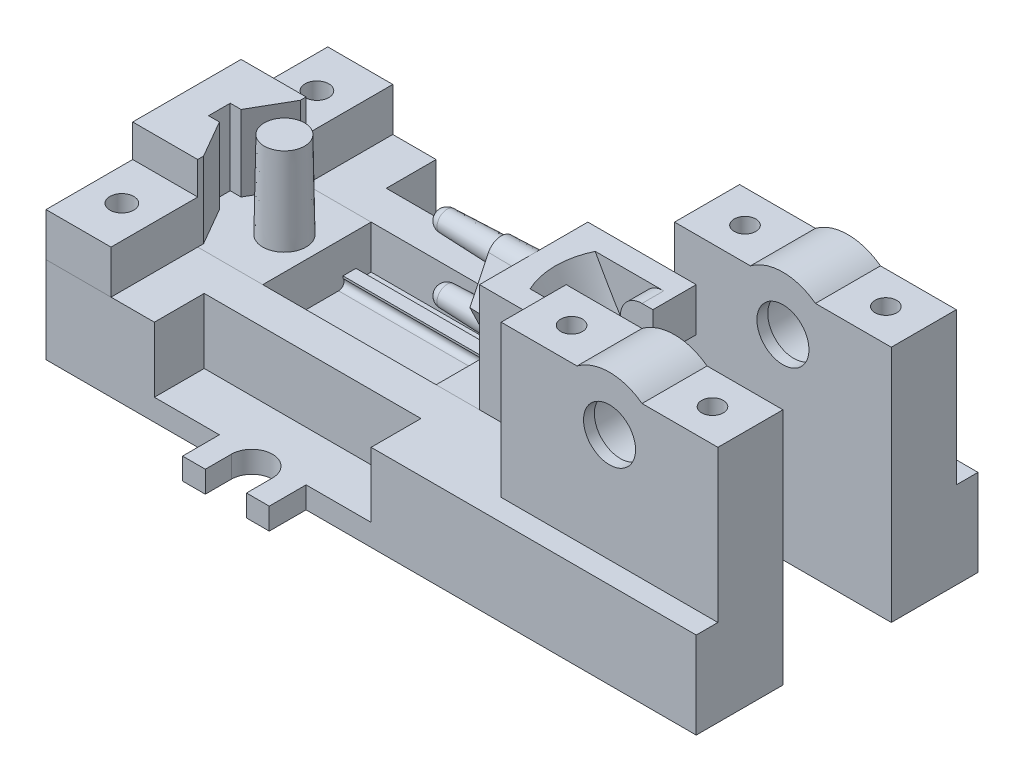
from build123d import *

# Parameters (mm, degrees)
SKETCH_1_W                = 200
SKETCH_1_H                = 50
EXTRUDE_1_DEPTH           = 200
EXTRUDE_2_DEPTH           = 35
SKETCH_3_W                = 30
SKETCH_3_H                = 40
SKETCH_3_R                = 5.5
EXTRUDE_3_DEPTH           = 20
CUT_EXTRUDE_6_DEPTH       = 200
EXTRUDE_4_DEPTH           = 60
SKETCH_6_R                = 10
EXTRUDE_5_DEPTH           = 40
EXTRUDE_5_TAPER           = 1
EXTRUDE_6_DEPTH           = 60
SKETCH_8_W                = 10
SKETCH_8_H                = 50
EXTRUDE_7_DEPTH           = 50
SKETCH_9_R                = 6
EXTRUDE_8_DEPTH           = 40
EXTRUDE_8_DRAFT           = 2
EXTRUDE_8_PROFILE_2_DEPTH = 40
EXTRUDE_8_PROFILE_2_DRAFT = 2
EXTRUDE_9_OUTLINE_R       = 5.476188458
EXTRUDE_9_DEPTH           = 15
EXTRUDE_9_TAPER           = -2
EXTRUDE_10_DEPTH          = 20
FILLET_1_R                = 10
EXTRUDE_11_DEPTH          = 100
EXTRUDE_12_DEPTH          = 30
SKETCH_19_W               = 5
SKETCH_19_H               = 3
EXTRUDE_13_REACH          = 383.608
EXTRUDE_13_END_RADIUS     = 25
SKETCH_22_W               = 30
SKETCH_22_H               = 20
SKETCH_18_W               = 100
SKETCH_18_H               = 50
CUT_EXTRUDE_7_DEPTH       = 50
CHAMFER_1_SIZE2           = 20
CHAMFER_1_SIZE            = 10
MIRROR_START              = 125
MIRROR_1_OUTLINE_R        = 15
MIRROR_1_DEPTH            = 30
MIRROR_1_2_OUTLINE_R      = 15
MIRROR_1_2_OUTLINE_R_2    = 12
MIRROR_1_2_DEPTH          = 5
MIRROR_START_2            = 150
MIRROR_1_3_OUTLINE_R      = 15
MIRROR_1_3_OUTLINE_R_2    = 12
MIRROR_1_3_DEPTH          = 5
CHAMFER_START             = 75
CHAMFER_2_DEPTH           = 50
CUT_EXTRUDE_8_DEPTH       = 369.272996566
CUT_EXTRUDE_8_DEPTH_BACK  = 369.272996566
SKETCH_23_W               = 180
SKETCH_23_H               = 17
CUT_EXTRUDE_10_DEPTH      = 10
SKETCH_25_W               = 100
SKETCH_25_H               = 40
CUT_EXTRUDE_9_DEPTH       = 30
SKETCH_27_R               = 5
CUT_EXTRUDE_11_DEPTH      = 15
SKETCH_28_R               = 5
CUT_EXTRUDE_12_DEPTH      = 35


with BuildPart() as part:
    # 草图1 → 凸台-拉伸1 (new body)
    with BuildSketch(Plane.XY):
        with Locations((100, 25)):
            Rectangle(SKETCH_1_W, SKETCH_1_H)
    extrude(amount=EXTRUDE_1_DEPTH)

    # 草图2 → 凸台-拉伸2 (add)
    with BuildSketch(Plane(origin=(0, 50, 0), x_dir=(1, 0, 0), z_dir=(0, 1, 0))):
        Polygon((0, -75), (30, -75), (30, -77.679491924), (20, -95), (15, -95), (15, -100), (15, -105), (20, -105), (30, -122.320508076), (30, -125), (0, -125), align=None)
    extrude(amount=EXTRUDE_2_DEPTH)

    # 草图3 → 凸台-拉伸3 (add)
    # profile 1 of 2: a face of its own
    with BuildSketch(Plane(origin=(0, 50, 0), x_dir=(1, 0, 0), z_dir=(0, 1, 0))):
        with Locations((15, -55)):
            Rectangle(SKETCH_3_W, SKETCH_3_H)
        with Locations(Location((15, -55, 0), (0, 0, 270))):
            Circle(SKETCH_3_R, mode=Mode.SUBTRACT)
    # profile 2 of 2: a face of its own
    with BuildSketch(Plane(origin=(0, 50, 0), x_dir=(1, 0, 0), z_dir=(0, 1, 0))):
        with Locations((15, -145)):
            Rectangle(SKETCH_3_W, SKETCH_3_H)
        with Locations(Location((15, -145, 0), (0, 0, 270))):
            Circle(SKETCH_3_R, mode=Mode.SUBTRACT)
    extrude(amount=EXTRUDE_3_DEPTH)


with BuildPart() as body_2:
    # Split Bodies 1: read off the stored shape, not the designer's step
    # Split Bodies 1: the piece on the far side of the plane
    add(part.part)
    split(bisect_by=Plane(origin=(0, 50, 0), x_dir=(1, 0, 0), z_dir=(0, 1, 0)), keep=Keep.BOTTOM)

    # 草图4 → 切除-拉伸6 (cut)
    with BuildSketch(Plane.ZY):
        with BuildLine():
            Line((100, 30), (100, 50))
            Line((100, 50), (75, 50))
            Line((75, 50), (75, 30))
            Line((75, 30), (80, 30))
            ThreePointArc((80, 30), (82.236067977, 31.381966011), (82, 34))
            Line((82, 34), (82, 35))
            Line((82, 35), (88, 35))
            Line((88, 35), (88, 34))
            ThreePointArc((88, 34), (87.763932023, 31.381966011), (90, 30))
            Line((90, 30), (100, 30))
        make_face()
        with BuildLine():
            Line((125, 30), (125, 50))
            Line((125, 50), (100, 50))
            Line((100, 50), (100, 30))
            Line((100, 30), (110, 30))
            ThreePointArc((110, 30), (112.236067977, 31.381966011), (112, 34))
            Line((112, 34), (112, 35))
            Line((112, 35), (118, 35))
            Line((118, 35), (118, 34))
            ThreePointArc((118, 34), (117.763932023, 31.381966011), (120, 30))
            Line((120, 30), (125, 30))
        make_face()
    extrude(amount=-CUT_EXTRUDE_6_DEPTH, mode=Mode.SUBTRACT)

    # 草图16 → 凸台-拉伸11 (add)
    with BuildSketch(Plane(origin=(200, 0, 0), x_dir=(0, 0, -1), z_dir=(1, 0, 0))):
        with BuildLine():
            Line((-125, 30), (-125, 50))
            Line((-125, 50), (-200, 50))
            Line((-200, 50), (-200, 0))
            Line((-200, 0), (0, 0))
            Line((0, 0), (0, 50))
            Line((0, 50), (-75, 50))
            Line((-75, 50), (-75, 30))
            Line((-75, 30), (-80, 30))
            ThreePointArc((-80, 30), (-82.236067977, 31.381966011), (-82, 34))
            Line((-82, 34), (-82, 35))
            Line((-82, 35), (-88, 35))
            Line((-88, 35), (-88, 34))
            ThreePointArc((-88, 34), (-87.763932023, 31.381966011), (-90, 30))
            Line((-90, 30), (-110, 30))
            ThreePointArc((-110, 30), (-112.236067977, 31.381966011), (-112, 34))
            Line((-112, 34), (-112, 35))
            Line((-112, 35), (-118, 35))
            Line((-118, 35), (-118, 34))
            ThreePointArc((-118, 34), (-117.763932023, 31.381966011), (-120, 30))
            Line((-120, 30), (-125, 30))
        make_face()
    extrude(amount=EXTRUDE_11_DEPTH)

    # 草图17 → 凸台-拉伸12 (add)
    with BuildSketch(Plane.XY.offset(75)):
        with BuildLine():
            ThreePointArc((275, 100), (250, 125), (225, 100))
            Line((225, 100), (235, 100))
            ThreePointArc((235, 100), (250, 115), (265, 100))
            Line((265, 100), (275, 100))
        make_face()
        with BuildLine():
            Line((235, 100), (225, 100))
            ThreePointArc((225, 100), (250, 75), (275, 100))
            Line((275, 100), (265, 100))
            ThreePointArc((265, 100), (250, 85), (235, 100))
        make_face()
        with BuildLine():
            Line((200, 100), (200, 50))
            Line((200, 50), (300, 50))
            Line((300, 50), (300, 100))
            Line((300, 100), (275, 100))
            ThreePointArc((275, 100), (250, 75), (225, 100))
            Line((225, 100), (200, 100))
        make_face()
    extrude(amount=-EXTRUDE_12_DEPTH)

    # 草图19 → 旋转4 (revolve)
    with BuildSketch(Plane(origin=(250, 0, 0), x_dir=(0, 0, -1), z_dir=(1, 0, 0)), mode=Mode.PRIVATE) as revolve_4_sk:
        with Locations((-72.5, 113.5)):
            Rectangle(SKETCH_19_W, SKETCH_19_H)
        with Locations((-47.5, 113.5)):
            Rectangle(SKETCH_19_W, SKETCH_19_H)
    revolve(revolve_4_sk.sketch.rotate(Axis((250, 100, 75), (0, 0, -1)), 180), axis=Axis((250, 100, 75), (0, 0, -1)))

    # 凸台-拉伸13: up to this cylinder (the profile starts outside it)
    extrude_13_end = Plane(origin=(250, 100, 60), z_dir=(0, 0, 1)) * Cylinder(EXTRUDE_13_END_RADIUS, 818.216, mode=Mode.PRIVATE)
    # 草图22 → 凸台-拉伸13 (add, up to the surface)
    with BuildSketch(Plane(origin=(300, 0, 0), x_dir=(0, 0, -1), z_dir=(1, 0, 0)), mode=Mode.PRIVATE) as extrude_13_sk1:
        with Locations((-60, 110)):
            Rectangle(SKETCH_22_W, SKETCH_22_H)
    extrude_13_tool1 = extrude(extrude_13_sk1.sketch, amount=-EXTRUDE_13_REACH, mode=Mode.PRIVATE) - extrude_13_end
    extrude_13 = extrude_13_tool1.solids().sort_by_distance((300, 110, 60))[0]
    add(extrude_13)

    # 镜向2: 凸台-拉伸13 across plane
    add(extrude_13.mirror(Plane(origin=(250, 0, 0), x_dir=(0, 0, 1), z_dir=(1, 0, 0))))

    # 草图18 → 切除-拉伸7 (cut)
    with BuildSketch(Plane(origin=(0, 50, 0), x_dir=(1, 0, 0), z_dir=(0, 1, 0))):
        with Locations((250, -100)):
            Rectangle(SKETCH_18_W, SKETCH_18_H)
    extrude(amount=-CUT_EXTRUDE_7_DEPTH, mode=Mode.SUBTRACT)

    # 镜向1: read off the stored shape, not the designer's step
    # 镜向1 outline → 镜向1 (add)
    with BuildSketch(Plane.XY.offset(MIRROR_START)):
        with BuildLine():
            ThreePointArc((265, 120), (250, 125), (235, 120))
            Line((235, 120), (200, 120))
            Line((200, 120), (200, 50))
            Line((200, 50), (300, 50))
            Line((300, 50), (300, 120))
            Line((300, 120), (265, 120))
        make_face()
        with Locations((250, 100)):
            Circle(MIRROR_1_OUTLINE_R, mode=Mode.SUBTRACT)
    extrude(amount=MIRROR_1_DEPTH)

    # Mirror 1 2 outline → Mirror 1 2 (add)
    with BuildSketch(Plane.XY.offset(MIRROR_START)):
        with Locations((250, 100)):
            Circle(MIRROR_1_2_OUTLINE_R)
        with Locations((250, 100)):
            Circle(MIRROR_1_2_OUTLINE_R_2, mode=Mode.SUBTRACT)
    extrude(amount=MIRROR_1_2_DEPTH)

    # Mirror 1 3 outline → Mirror 1 3 (add)
    with BuildSketch(Plane.XY.offset(MIRROR_START_2)):
        with Locations((250, 100)):
            Circle(MIRROR_1_3_OUTLINE_R)
        with Locations((250, 100)):
            Circle(MIRROR_1_3_OUTLINE_R_2, mode=Mode.SUBTRACT)
    extrude(amount=MIRROR_1_3_DEPTH)

    # 倒角2: read off the stored shape, not the designer's step
    # 倒角2 outline → 倒角2 (cut)
    with BuildSketch(Plane.XY.offset(CHAMFER_START)):
        Polygon((200, 20), (200, 35), (185, 35), align=None)
    extrude(amount=CHAMFER_2_DEPTH, mode=Mode.SUBTRACT)

    # 草图23 → 切除-拉伸8 (cut, two sides: drawn at the far end of the back side and taken through both)
    with BuildSketch(Plane(origin=(0, 50, 0), x_dir=(1, 0, 0), z_dir=(0, 1, 0)).offset(-CUT_EXTRUDE_8_DEPTH_BACK)):
        Polygon((80, -182), (80, -200), (300, -200), (300, -182), (120, -182), (109.5, -182), (90.5, -182), align=None)
        Polygon((0, -200), (80, -200), (80, -182), (80, -165), (0, -165), align=None)
        with Locations((210, -173.5)):
            Rectangle(SKETCH_23_W, SKETCH_23_H)
        with BuildLine():
            Line((90.5, -170), (90.5, -182))
            Line((90.5, -182), (109.5, -182))
            Line((109.5, -182), (109.5, -170))
            ThreePointArc((109.5, -170), (100, -179.5), (90.5, -170))
        make_face()
        with BuildLine():
            ThreePointArc((109.5, -170), (100, -160.5), (90.5, -170))
            Line((90.5, -170), (109.5, -170))
        make_face()
        with BuildLine():
            Line((109.5, -170), (90.5, -170))
            ThreePointArc((90.5, -170), (100, -179.5), (109.5, -170))
        make_face()
        with Locations((210, -26.5)):
            Rectangle(SKETCH_23_W, SKETCH_23_H)
        Polygon((120, -18), (300, -18), (300, 0), (80, 0), (80, -18), (90.5, -18), (109.5, -18), align=None)
        with BuildLine():
            Line((109.5, -30), (109.5, -18))
            Line((109.5, -18), (90.5, -18))
            Line((90.5, -18), (90.5, -30))
            ThreePointArc((90.5, -30), (100, -20.5), (109.5, -30))
        make_face()
        Polygon((80, -18), (80, 0), (0, 0), (0, -35), (80, -35), align=None)
        with BuildLine():
            ThreePointArc((90.5, -30), (100, -39.5), (109.5, -30))
            Line((109.5, -30), (90.5, -30))
        make_face()
        with BuildLine():
            Line((90.5, -30), (109.5, -30))
            ThreePointArc((109.5, -30), (100, -20.5), (90.5, -30))
        make_face()
    extrude(amount=CUT_EXTRUDE_8_DEPTH + CUT_EXTRUDE_8_DEPTH_BACK, mode=Mode.SUBTRACT)

    # 草图26 → 切除-拉伸10 (cut)
    with BuildSketch(Plane.XZ):
        with BuildLine():
            Line((0, 165), (0, 35))
            Line((0, 35), (80, 35))
            Line((80, 35), (80, 18))
            Line((80, 18), (90.5, 18))
            Line((90.5, 18), (90.5, 30))
            ThreePointArc((90.5, 30), (100, 39.5), (109.5, 30))
            Line((109.5, 30), (109.5, 18))
            Line((109.5, 18), (120, 18))
            Line((120, 18), (120, 35))
            Line((120, 35), (300, 35))
            Line((300, 35), (300, 75))
            Line((300, 75), (200, 75))
            Line((200, 75), (200, 125))
            Line((200, 125), (300, 125))
            Line((300, 125), (300, 165))
            Line((300, 165), (120, 165))
            Line((120, 165), (120, 182))
            Line((120, 182), (109.5, 182))
            Line((109.5, 182), (109.5, 170))
            ThreePointArc((109.5, 170), (100, 160.5), (90.5, 170))
            Line((90.5, 170), (90.5, 182))
            Line((90.5, 182), (80, 182))
            Line((80, 182), (80, 165))
            Line((80, 165), (0, 165))
        make_face()
    extrude(amount=-CUT_EXTRUDE_10_DEPTH, mode=Mode.SUBTRACT)

    # 草图25 → 切除-拉伸9 (cut)
    with BuildSketch(Plane(origin=(0, 50, 0), x_dir=(1, 0, 0), z_dir=(0, 1, 0))):
        with Locations((100, -38)):
            Rectangle(SKETCH_25_W, SKETCH_25_H)
        with Locations((100, -162)):
            Rectangle(SKETCH_25_W, SKETCH_25_H)
    extrude(amount=-CUT_EXTRUDE_9_DEPTH, mode=Mode.SUBTRACT)

    # 草图27 → 切除-拉伸11 (cut)
    with BuildSketch(Plane(origin=(0, 50, 0), x_dir=(1, 0, 0), z_dir=(0, 1, 0))):
        with Locations(Location((15, -145, 0), (0, 0, 270))):
            Circle(SKETCH_27_R)
        with Locations(Location((15, -55, 0), (0, 0, 270))):
            Circle(SKETCH_27_R)
    extrude(amount=-CUT_EXTRUDE_11_DEPTH, mode=Mode.SUBTRACT)

    # 草图28 → 切除-拉伸12 (cut)
    with BuildSketch(Plane(origin=(0, 120, 0), x_dir=(1, 0, 0), z_dir=(0, 1, 0))):
        with Locations(Location((282.5, -140, 0), (0, 0, 270))):
            Circle(SKETCH_28_R)
        with Locations(Location((217.5, -140, 0), (0, 0, 270))):
            Circle(SKETCH_28_R)
        with Locations(Location((282.5, -60, 0), (0, 0, 270))):
            Circle(SKETCH_28_R)
        with Locations(Location((217.5, -60, 0), (0, 0, 270))):
            Circle(SKETCH_28_R)
    extrude(amount=-CUT_EXTRUDE_12_DEPTH, mode=Mode.SUBTRACT)


with BuildPart() as part_1:
    add(part.part)

    # Split Bodies 1
    split(bisect_by=Plane(origin=(0, 50, 0), x_dir=(1, 0, 0), z_dir=(0, 1, 0)), keep=Keep.TOP)


with BuildPart() as body_3:
    # 草图5 → 凸台-拉伸4 (new body)
    with BuildSketch(Plane.ZY):
        with BuildLine():
            Line((75, 50), (125, 50))
            Line((125, 50), (125, 30))
            Line((125, 30), (120, 30))
            ThreePointArc((120, 30), (117.763932023, 31.381966011), (118, 34))
            Line((118, 34), (118, 35))
            Line((118, 35), (112, 35))
            Line((112, 35), (112, 34))
            ThreePointArc((112, 34), (112.236067977, 31.381966011), (110, 30))
            Line((110, 30), (90, 30))
            ThreePointArc((90, 30), (87.763932023, 31.381966011), (88, 34))
            Line((88, 34), (88, 35))
            Line((88, 35), (82, 35))
            Line((82, 35), (82, 34))
            ThreePointArc((82, 34), (82.236067977, 31.381966011), (80, 30))
            Line((80, 30), (75, 30))
            Line((75, 30), (75, 50))
        make_face()
    extrude(amount=-EXTRUDE_4_DEPTH)

    # 草图6 → 凸台-拉伸5 (add)
    with BuildSketch(Plane(origin=(0, 50, 0), x_dir=(1, 0, 0), z_dir=(0, 1, 0))):
        with Locations((45, -100)):
            Circle(SKETCH_6_R)
    extrude(amount=EXTRUDE_5_DEPTH, taper=EXTRUDE_5_TAPER)


with BuildPart() as body_4:
    # 草图7 → 凸台-拉伸6 (new body)
    with BuildSketch(Plane(origin=(200, 0, 0), x_dir=(0, 0, -1), z_dir=(1, 0, 0))):
        with BuildLine():
            Line((-125, 50), (-75, 50))
            Line((-75, 50), (-75, 30))
            Line((-75, 30), (-80, 30))
            ThreePointArc((-80, 30), (-82.236067977, 31.381966011), (-82, 34))
            Line((-82, 34), (-82, 35))
            Line((-82, 35), (-88, 35))
            Line((-88, 35), (-88, 34))
            ThreePointArc((-88, 34), (-87.763932023, 31.381966011), (-90, 30))
            Line((-90, 30), (-110, 30))
            ThreePointArc((-110, 30), (-112.236067977, 31.381966011), (-112, 34))
            Line((-112, 34), (-112, 35))
            Line((-112, 35), (-118, 35))
            Line((-118, 35), (-118, 34))
            ThreePointArc((-118, 34), (-117.763932023, 31.381966011), (-120, 30))
            Line((-120, 30), (-125, 30))
            Line((-125, 30), (-125, 50))
        make_face()
    extrude(amount=-EXTRUDE_6_DEPTH)

    # 草图8 → 凸台-拉伸7 (add)
    with BuildSketch(Plane(origin=(0, 50, 0), x_dir=(1, 0, 0), z_dir=(0, 1, 0))):
        with Locations((175, -100)):
            Rectangle(SKETCH_8_W, SKETCH_8_H)
        with Locations((165, -100)):
            Rectangle(SKETCH_8_W, SKETCH_8_H)
    extrude(amount=EXTRUDE_7_DEPTH)


with BuildPart() as extrude_8_tool:
    # 草图9 → 凸台-拉伸8 (with draft: the straight prism first)
    with BuildSketch(Plane.ZY.offset(-160)):
        with Locations((100, 93)):
            Circle(SKETCH_9_R)
    extrude(amount=EXTRUDE_8_DEPTH)
    # 凸台-拉伸8: the draft: its side faces are tilted about the plane it starts from
    extrude_8_sides = [extrude_8_tool.faces().sort_by_distance(p)[0] for p in [
        (140, 93, 94),
    ]]
    draft(extrude_8_sides, Plane.ZY.offset(-160), EXTRUDE_8_DRAFT)


with BuildPart() as body_4_1:
    add(body_4.part)

    # 凸台-拉伸8: add extrude_8_tool
    add(extrude_8_tool.part)


with BuildPart() as extrude_8_profile_2_tool:
    # 草图9 → 凸台-拉伸8 profile 2 (with draft: the straight prism first)
    with BuildSketch(Plane.ZY.offset(-160)):
        with Locations((100, 63)):
            Circle(SKETCH_9_R)
    extrude(amount=EXTRUDE_8_PROFILE_2_DEPTH)
    # 凸台-拉伸8 profile 2: the draft: its side faces are tilted about the plane it starts from
    extrude_8_profile_2_sides = [extrude_8_profile_2_tool.faces().sort_by_distance(p)[0] for p in [
        (140, 63, 94),
    ]]
    draft(extrude_8_profile_2_sides, Plane.ZY.offset(-160), EXTRUDE_8_PROFILE_2_DRAFT)


with BuildPart() as body_4_2:
    add(body_4_1.part)

    # 凸台-拉伸8 profile 2: add extrude_8_profile_2_tool
    add(extrude_8_profile_2_tool.part)

    # 草图11 → 旋转2 (revolve)
    with BuildSketch(Plane.XY.offset(100)):
        with BuildLine():
            Line((120, 97.600365094), (120, 93))
            Line((120, 93), (115.399634906, 93))
            ThreePointArc((115.399634906, 93), (116.747050646, 96.252949354), (120, 97.600365094))
        make_face()
    revolve(axis=Axis((120, 93, 100), (1, 0, 0)))

    # 草图13 one side → 旋转3 (revolve)
    with BuildSketch(Plane.XY.offset(100)):
        with BuildLine():
            ThreePointArc((115.399634906, 63), (120, 58.399634906), (124.600365094, 63))
            Line((124.600365094, 63), (120, 63))
            Line((120, 63), (115.399634906, 63))
        make_face()
        with BuildLine():
            Line((120, 63), (120, 67.600365094))
            ThreePointArc((120, 67.600365094), (116.747050646, 66.252949354), (115.399634906, 63))
            Line((115.399634906, 63), (120, 63))
        make_face()
    revolve(axis=Axis((120, 63, 100), (-1, 0, 0)))

    # 凸台-拉伸9: read off the stored shape, not the designer's step
    # 凸台-拉伸9 outline → 凸台-拉伸9 (add)
    with BuildSketch(Plane.ZY.offset(-145)):
        with BuildLine():
            Line((114.418525242, 78), (105.833963067, 95.811741787))
            ThreePointArc((105.833963067, 95.811741787), (100, 99.476188458), (94.166036933, 95.811741787))
            Line((94.166036933, 95.811741787), (85.581474758, 78))
            Line((85.581474758, 78), (94.166036933, 60.188258213))
            ThreePointArc((94.166036933, 60.188258213), (100, 56.523811542), (105.833963067, 60.188258213))
            Line((105.833963067, 60.188258213), (114.418525242, 78))
        make_face()
        with Locations((100, 63)):
            Circle(EXTRUDE_9_OUTLINE_R, mode=Mode.SUBTRACT)
        with Locations((100, 93)):
            Circle(EXTRUDE_9_OUTLINE_R, mode=Mode.SUBTRACT)
    extrude(amount=-EXTRUDE_9_DEPTH, taper=EXTRUDE_9_TAPER)

    # 草图15 → 凸台-拉伸10 (add)
    with BuildSketch(Plane(origin=(0, 100, 0), x_dir=(1, 0, 0), z_dir=(0, 1, 0))):
        with BuildLine():
            Line((180, -75), (180, -100))
            ThreePointArc((180, -100), (181.282917549, -92.09430585), (185, -85))
            Line((185, -85), (195, -85))
            Line((195, -85), (195, -95))
            Line((195, -95), (210, -95))
            Line((210, -95), (210, -75))
            Line((210, -75), (180, -75))
        make_face()
        with BuildLine():
            Line((180, -100), (180, -125))
            Line((180, -125), (210, -125))
            Line((210, -125), (210, -105))
            Line((210, -105), (195, -105))
            Line((195, -105), (195, -115))
            Line((195, -115), (185, -115))
            ThreePointArc((185, -115), (181.282917549, -107.90569415), (180, -100))
        make_face()
    extrude(amount=-EXTRUDE_10_DEPTH)

    # Fillet 1
    fillet_1_edges = [body_4_2.edges().sort_by_distance(p)[0] for p in [
        (195, 100, 110),
        (195, 80, 110),
        (195, 100, 90),
        (195, 80, 90),
    ]]
    fillet(fillet_1_edges, radius=FILLET_1_R - 0.0001)  # a hair under: the kernel refuses the full size

    # Chamfer 1
    chamfer_1_edges = [body_4_2.edges().sort_by_distance(p)[0] for p in [
        (180, 100, 100),
    ]]
    chamfer_1_side = [body_4_2.faces().sort_by_distance(p)[0] for p in [
        (179.8, 100, 100),
    ]]
    chamfer(chamfer_1_edges, length=CHAMFER_1_SIZE - 0.0001, length2=CHAMFER_1_SIZE2 - 0.0001, reference=chamfer_1_side[0])  # a hair under: the kernel refuses the full size


solid = Compound([body_2.part, part_1.part, body_3.part, body_4_2.part])
